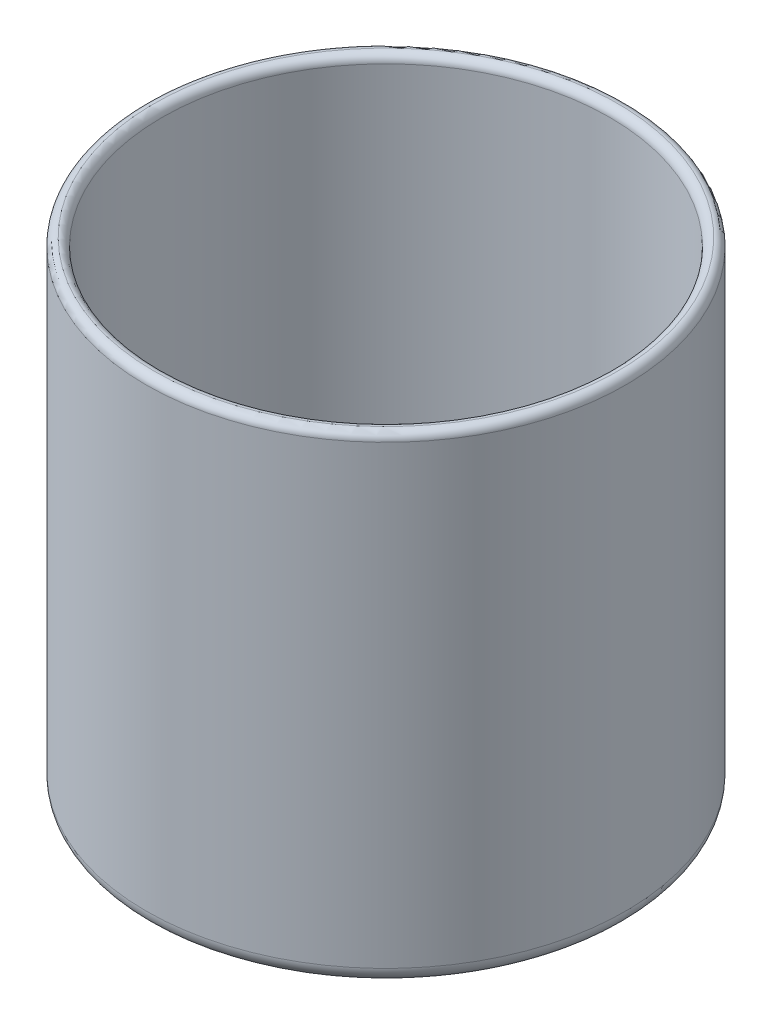
from build123d import *

# Parameters (mm, degrees)
SKETCH_1_R          = 30
EXTRUDE_1_DEPTH     = 60
SKETCH_2_R          = 28
CUT_EXTRUDE_1_DEPTH = 55
SKETCH_3_R          = 1.5
CUT_EXTRUDE_2_DEPTH = 5
FILLET_1_R          = 2
FILLET_2_R          = 2
FILLET_3_R          = 2
FILLET_4_R          = 1
FILLET_5_R          = 1
FILLET_6_R          = 1


with BuildPart() as part:
    # Эскиз1 → Бобышка-Вытянуть1 (new body)
    with BuildSketch(Plane(origin=(0, 0, 0), x_dir=(1, 0, 0), z_dir=(0, 1, 0))):
        with Locations(Location((0, 0, 0), (0, 0, 270))):
            Circle(SKETCH_1_R)
    extrude(amount=EXTRUDE_1_DEPTH)

    # Эскиз2 → Вырез-Вытянуть1 (cut)
    with BuildSketch(Plane(origin=(0, 60, 0), x_dir=(1, 0, 0), z_dir=(0, 1, 0))):
        with Locations(Location((0, 0, 0), (0, 0, 270))):
            Circle(SKETCH_2_R)
    extrude(amount=-CUT_EXTRUDE_1_DEPTH, mode=Mode.SUBTRACT)

    # Эскиз3 → Вырез-Вытянуть2 (cut)
    with BuildSketch(Plane.XZ):
        with Locations(Location((0, 10, 0), (0, 0, 270))):
            Circle(SKETCH_3_R)
        with Locations(Location((0, -10, 0), (0, 0, 270))):
            Circle(SKETCH_3_R)
        with Locations(Location((10, 0, 0), (0, 0, 270))):
            Circle(SKETCH_3_R)
        with Locations(Location((-10, 0, 0), (0, 0, 270))):
            Circle(SKETCH_3_R)
    extrude(amount=-CUT_EXTRUDE_2_DEPTH, mode=Mode.SUBTRACT)

    # Скругление1
    fillet_1_edges = [part.edges().sort_by_distance(p)[0] for p in [
        (0, 0, -30),
    ]]
    fillet(fillet_1_edges, radius=FILLET_1_R)

    # Скругление2
    fillet_2_edges = [part.edges().sort_by_distance(p)[0] for p in [
        (0, 5, -28),
    ]]
    fillet(fillet_2_edges, radius=FILLET_2_R)

    # Скругление3
    fillet_3_edges = [part.edges().sort_by_distance(p)[0] for p in [
        (0, 5, 11.5),
        (0, 5, -8.5),
        (10, 5, 1.5),
        (-10, 5, 1.5),
    ]]
    fillet(fillet_3_edges, radius=FILLET_3_R)

    # Скругление4
    fillet_4_edges = [part.edges().sort_by_distance(p)[0] for p in [
        (0, 0, 11.5),
        (0, 0, -8.5),
        (10, 0, 1.5),
        (-10, 0, 1.5),
    ]]
    fillet(fillet_4_edges, radius=FILLET_4_R)

    # Скругление5
    fillet_5_edges = [part.edges().sort_by_distance(p)[0] for p in [
        (0, 60, -30),
    ]]
    fillet(fillet_5_edges, radius=FILLET_5_R)

    # Скругление6
    fillet_6_edges = [part.edges().sort_by_distance(p)[0] for p in [
        (0, 60, -28),
    ]]
    fillet(fillet_6_edges, radius=FILLET_6_R - 0.0001)  # a hair under: the kernel refuses the full size


solid = part.part
